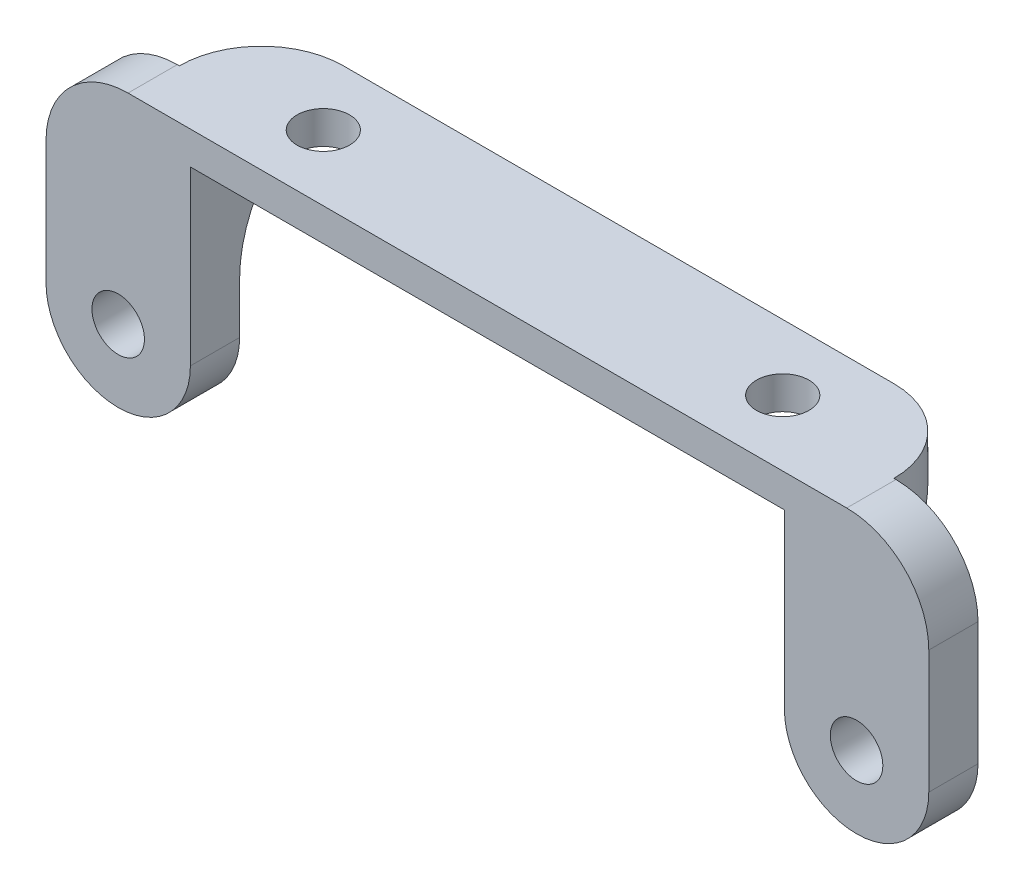
from build123d import *

# Parameters (mm, degrees)
SKETCH_1_R           = 4.4
SKETCH_1_R_2         = 1.6
EXTRUDE_1_DEPTH      = 3
EXTRUDE_1_2_DEPTH    = 3
EXTRUDE_2_DEPTH      = 3
SKETCH_3_R           = 1.6
EXTRUDE_3_DEPTH      = 2
FILLET_1_R           = 5
FILLET_START         = 10.425156935
FILLET_2_DEPTH       = 2.074843065
FILLET_START_2       = 3.083801413
FILLET_2_2_DEPTH     = 7.341355522
FILLET_2_3_OUTLINE_W = 8
FILLET_2_3_OUTLINE_H = 3.675


with BuildPart() as part:
    # 草图1 → 凸台-拉伸1 (new body)
    with BuildSketch(Plane.XY):
        with Locations(Location((-22.5, 0, 0), (0, 0, 180))):
            Circle(SKETCH_1_R)
        with Locations(Location((-22.5, 0, 0), (0, 0, 180))):
            Circle(SKETCH_1_R_2, mode=Mode.SUBTRACT)
    extrude(amount=EXTRUDE_1_DEPTH)



with BuildPart() as body_2:
    # 草图1 → Extrude 1 2 (new body)
    with BuildSketch(Plane.XY):
        with Locations((22.5, 0)):
            Circle(SKETCH_1_R)
        with Locations((22.5, 0)):
            Circle(SKETCH_1_R_2, mode=Mode.SUBTRACT)
    extrude(amount=EXTRUDE_1_2_DEPTH)


with BuildPart() as part_1:
    add(part.part)

    add(body_2.part)  # 凸台-拉伸2 merges body 2
    # 草图2 → 凸台-拉伸2 (add)
    with BuildSketch(Plane.XY):
        with BuildLine():
            Line((-26.9, 0), (-26.9, 10.5))
            Line((-26.9, 10.5), (-18.1, 10.5))
            Line((-18.1, 10.5), (-18.1, 0))
            ThreePointArc((-18.1, 0), (-22.5, 4.4), (-26.9, 0))
        make_face()
        with BuildLine():
            Line((18.1, 10.5), (18.1, 0))
            ThreePointArc((18.1, 0), (22.5, 4.4), (26.9, 0))
            Line((26.9, 0), (26.9, 10.5))
            Line((26.9, 10.5), (18.1, 10.5))
        make_face()
    extrude(amount=EXTRUDE_2_DEPTH)

    # 草图3 → 凸台-拉伸3 (add)
    with BuildSketch(Plane(origin=(0, 10.5, 0), x_dir=(1, 0, 0), z_dir=(0, 1, 0))):
        Polygon((-12.220864979, -3), (12.220864979, -3), (26.9, -3), (26.9, 0), (21.775, 0), (21.775, 5), (-21.775, 5), (-21.775, 0), (-26.9, 0), (-26.9, -3), align=None)
        with Locations(Location((14, 1, 0), (0, 0, 270))):
            Circle(SKETCH_3_R, mode=Mode.SUBTRACT)
        with Locations(Location((-14, 1, 0), (0, 0, 270))):
            Circle(SKETCH_3_R, mode=Mode.SUBTRACT)
    extrude(amount=EXTRUDE_3_DEPTH)

    # 圆角1
    fillet_1_edges = [part_1.edges().sort_by_distance(p)[0] for p in [
        (26.9, 12.5, 1.5),
        (-26.9, 12.5, 1.5),
        (-21.775, 11.5, -5),
        (21.775, 11.5, -5),
    ]]
    fillet(fillet_1_edges, radius=FILLET_1_R - 0.0001)  # a hair under: the kernel refuses the full size

    # 圆角2: read off the stored shape, not the designer's step
    # 圆角2 outline → 圆角2 (add)
    with BuildSketch(Plane(origin=(0, 0, 0), x_dir=(1, 0, 0), z_dir=(0, 1, 0)).offset(FILLET_START)):
        with BuildLine():
            Line((-18.1, 0), (-18.1, 4.82124206))
            ThreePointArc((-18.1, 4.82124206), (-20.75149343, 3.031088913), (-21.775, 0))
            Line((-21.775, 0), (-18.1, 0))
        make_face()
        with BuildLine():
            Line((18.1, 4.82124206), (18.1, 0))
            Line((18.1, 0), (21.775, 0))
            ThreePointArc((21.775, 0), (20.75149343, 3.031088913), (18.1, 4.82124206))
        make_face()
    extrude(amount=FILLET_2_DEPTH)

    # Fillet 2 2 outline → Fillet 2 2 (add)
    with BuildSketch(Plane(origin=(0, 0, 0), x_dir=(1, 0, 0), z_dir=(0, 1, 0)).offset(FILLET_START_2)):
        with BuildLine():
            Line((-18.1, 0), (-18.1, 4.82124206))
            ThreePointArc((-18.1, 4.82124206), (-20.75149343, 3.031088913), (-21.775, 0))
            Line((-21.775, 0), (-18.1, 0))
        make_face()
        with BuildLine():
            Line((18.1, 4.82124206), (18.1, 0))
            Line((18.1, 0), (21.775, 0))
            ThreePointArc((21.775, 0), (20.75149343, 3.031088913), (18.1, 4.82124206))
        make_face()
    extrude(amount=FILLET_2_2_DEPTH)

    # Fillet 2 3 outline → Fillet 2 3 (revolve, cut)
    with BuildSketch(Plane(origin=(0, 3.083801513, -8), x_dir=(0, 1, 0), z_dir=(0, 0, -1))):
        with Locations((4, -19.9375)):
            Rectangle(FILLET_2_3_OUTLINE_W, FILLET_2_3_OUTLINE_H)
        with Locations((4, 19.9375)):
            Rectangle(FILLET_2_3_OUTLINE_W, FILLET_2_3_OUTLINE_H)
    revolve(axis=Axis((0, 3.083801513, -8), (1, 0, 0)), mode=Mode.SUBTRACT)


solid = part_1.part
